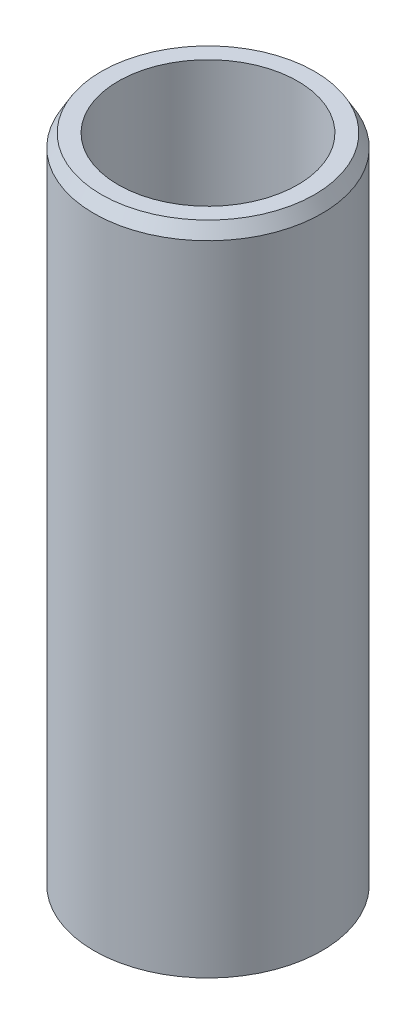
from build123d import *
from OCP.BRepFilletAPI import BRepFilletAPI_MakeChamfer

# Parameters (mm, degrees)
SKETCH1_R           = 50
BOSS_EXTRUDE1_DEPTH = 288.745215292
SKETCH2_R           = 39.367844532
CUT_EXTRUDE1_DEPTH  = 298.277310526
CHAMFER1_SIZE       = 5.577754347
CHAMFER1_SIZE2      = 3.220317974


with BuildPart() as part:
    # Sketch1 → Boss-Extrude1 (new body)
    with BuildSketch(Plane(origin=(0, 0, 0), x_dir=(1, 0, 0), z_dir=(0, 1, 0))):
        Circle(SKETCH1_R)
    extrude(amount=BOSS_EXTRUDE1_DEPTH)

    # Sketch2 → Cut-Extrude1 (cut, through all)
    with BuildSketch(Plane(origin=(0, 0, 0), x_dir=(1, 0, 0), z_dir=(0, 1, 0))):
        Circle(SKETCH2_R)
    extrude(amount=CUT_EXTRUDE1_DEPTH, mode=Mode.SUBTRACT)

    # Chamfer1: one chamfer whose edges measure the first distance from different faces: ONE call of the kernel's chamfer builder (chamfer() names one face for all edges)
    chamfer1_edges_1 = [part.edges().sort_by_distance(p)[0] for p in [
        (-50, 288.745215292, 0),
    ]]
    chamfer1_side_1 = [part.faces().sort_by_distance(p)[0] for p in [
        (-50, 144.372607646, 0),
    ]]
    chamfer1_edges_2 = [part.edges().sort_by_distance(p)[0] for p in [
        (-50, 0, 0),
    ]]
    chamfer1_side_2 = [part.faces().sort_by_distance(p)[0] for p in [
        (-48.585786438, 0, 0),
    ]]
    chamfer1 = BRepFilletAPI_MakeChamfer(part.part.solid().wrapped)
    for e in chamfer1_edges_1:
        chamfer1.Add(CHAMFER1_SIZE, CHAMFER1_SIZE2, e.wrapped, chamfer1_side_1[0].wrapped)  # the first distance lies on this face
    for e in chamfer1_edges_2:
        chamfer1.Add(CHAMFER1_SIZE, CHAMFER1_SIZE2, e.wrapped, chamfer1_side_2[0].wrapped)  # the first distance lies on this face
    add(Compound.cast(chamfer1.Shape()), mode=Mode.REPLACE)


solid = part.part
